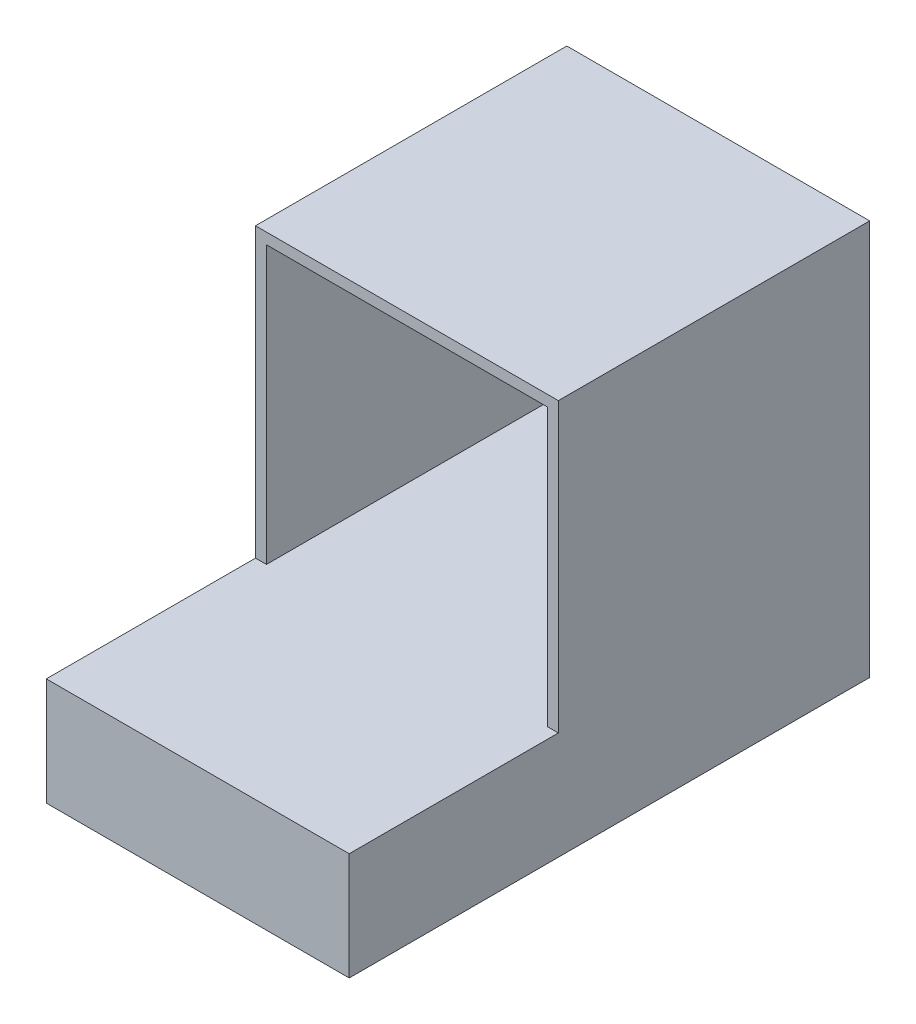
from build123d import *

# Parameters (mm, degrees)
SKETCH1_W           = 131.318
SKETCH1_H           = 171.45
BOSS_EXTRUDE1_DEPTH = 134.9756
SKETCH2_W           = 131.318
SKETCH2_H           = 46.6598
BOSS_EXTRUDE2_DEPTH = 90.678
SHELL1_OUTLINE_W    = 121.793
SHELL1_OUTLINE_H    = 161.925
SHELL1_DEPTH        = 134.9756
SHELL1_START        = 134.9756
SHELL1_2_OUTLINE_W  = 121.793
SHELL1_2_OUTLINE_H  = 37.1348
SHELL1_2_DEPTH      = 85.9155
SKETCH3_W           = 131.318
SKETCH3_H           = 134.9756
BOSS_EXTRUDE3_DEPTH = 4.7625


# Read off the part's stored shape, not the designer's step: Shell1
with BuildPart() as part:
    # Sketch1 → Boss-Extrude1 (new body)
    with BuildSketch(Plane.XY):
        with Locations((65.659, 85.725)):
            Rectangle(SKETCH1_W, SKETCH1_H)
    extrude(amount=BOSS_EXTRUDE1_DEPTH)

    # Sketch2 → Boss-Extrude2 (add)
    with BuildSketch(Plane.XY.offset(134.9756)):
        with Locations((65.659, 23.3299)):
            Rectangle(SKETCH2_W, SKETCH2_H)
    extrude(amount=BOSS_EXTRUDE2_DEPTH)

    # Shell1 outline → Shell1 (cut)
    with BuildSketch(Plane.XY):
        with Locations((65.659, 85.725)):
            Rectangle(SHELL1_OUTLINE_W, SHELL1_OUTLINE_H)
    extrude(amount=SHELL1_DEPTH, mode=Mode.SUBTRACT)

    # Shell1 2 outline → Shell1 2 (cut)
    with BuildSketch(Plane.XY.offset(SHELL1_START)):
        with Locations((65.659, 23.3299)):
            Rectangle(SHELL1_2_OUTLINE_W, SHELL1_2_OUTLINE_H)
    extrude(amount=SHELL1_2_DEPTH, mode=Mode.SUBTRACT)

    # Sketch3 → Boss-Extrude3 (add)
    with BuildSketch(Plane(origin=(0, 46.6598, 0), x_dir=(1, 0, 0), z_dir=(0, 1, 0))):
        with Locations((65.659, -67.4878)):
            Rectangle(SKETCH3_W, SKETCH3_H)
    extrude(amount=-BOSS_EXTRUDE3_DEPTH)


solid = part.part
